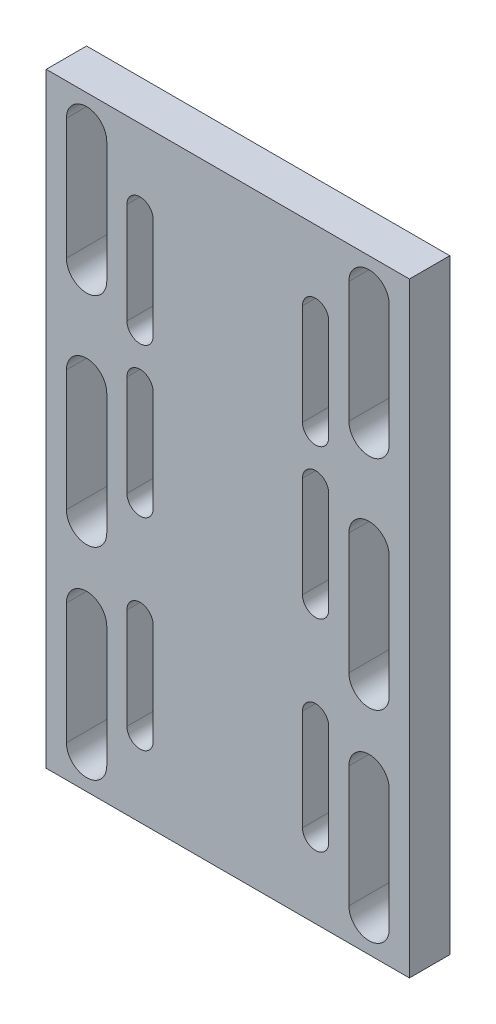
from build123d import *

# Parameters (mm, degrees)
SPLIT_START       = 45
SPLIT_1_OUTLINE_W = 90
SPLIT_1_OUTLINE_H = 100
SPLIT_1_DEPTH     = 10
SKETCH_1_W        = 90
SKETCH_1_H        = 50
EXTRUDE_1_DEPTH   = 10


# Read off the part's stored shape, not the designer's step: 基材零件-專題-1
with BuildPart() as part:
    # Split 1 outline → Split 1 (new body)
    with BuildSketch(Plane.XY.offset(SPLIT_START)):
        with Locations((0, -42)):
            Rectangle(SPLIT_1_OUTLINE_W, SPLIT_1_OUTLINE_H)
        with BuildLine():
            Line((-40, -84), (-40, -54))
            ThreePointArc((-40, -54), (-35, -49), (-30, -54))
            Line((-30, -54), (-30, -84))
            ThreePointArc((-30, -84), (-35, -89), (-40, -84))
        make_face(mode=Mode.SUBTRACT)
        with BuildLine():
            Line((-25, -73), (-25, -48))
            ThreePointArc((-25, -48), (-21.75, -44.75), (-18.5, -48))
            Line((-18.5, -48), (-18.5, -73))
            ThreePointArc((-18.5, -73), (-21.75, -76.25), (-25, -73))
        make_face(mode=Mode.SUBTRACT)
        with BuildLine():
            Line((30, -84), (30, -54))
            ThreePointArc((30, -54), (35, -49), (40, -54))
            Line((40, -54), (40, -84))
            ThreePointArc((40, -84), (35, -89), (30, -84))
        make_face(mode=Mode.SUBTRACT)
        with BuildLine():
            Line((18.5, -73), (18.5, -48))
            ThreePointArc((18.5, -48), (21.75, -44.75), (25, -48))
            Line((25, -48), (25, -73))
            ThreePointArc((25, -73), (21.75, -76.25), (18.5, -73))
        make_face(mode=Mode.SUBTRACT)
        with BuildLine():
            Line((-18.5, -11), (-18.5, -36))
            ThreePointArc((-18.5, -36), (-21.75, -39.25), (-25, -36))
            Line((-25, -36), (-25, -11))
            ThreePointArc((-25, -11), (-21.75, -7.75), (-18.5, -11))
        make_face(mode=Mode.SUBTRACT)
        with BuildLine():
            ThreePointArc((-30, -30), (-35, -35), (-40, -30))
            Line((-40, -30), (-40, 0))
            ThreePointArc((-40, 0), (-35, 5), (-30, 0))
            Line((-30, 0), (-30, -30))
        make_face(mode=Mode.SUBTRACT)
        with BuildLine():
            Line((25, -11), (25, -36))
            ThreePointArc((25, -36), (21.75, -39.25), (18.5, -36))
            Line((18.5, -36), (18.5, -11))
            ThreePointArc((18.5, -11), (21.75, -7.75), (25, -11))
        make_face(mode=Mode.SUBTRACT)
        with BuildLine():
            ThreePointArc((40, -30), (35, -35), (30, -30))
            Line((30, -30), (30, 0))
            ThreePointArc((30, 0), (35, 5), (40, 0))
            Line((40, 0), (40, -30))
        make_face(mode=Mode.SUBTRACT)
    extrude(amount=SPLIT_1_DEPTH)

    # 草圖1 → 填料-伸長1 (add)
    with BuildSketch(Plane.XY.offset(55)):
        with Locations((0, -117)):
            Rectangle(SKETCH_1_W, SKETCH_1_H)
        with BuildLine():
            Line((40, -134), (40, -104))
            ThreePointArc((40, -104), (35, -99), (30, -104))
            Line((30, -104), (30, -134))
            ThreePointArc((30, -134), (35, -139), (40, -134))
        make_face(mode=Mode.SUBTRACT)
        with BuildLine():
            Line((25, -123), (25, -98))
            ThreePointArc((25, -98), (21.75, -94.75), (18.5, -98))
            Line((18.5, -98), (18.5, -123))
            ThreePointArc((18.5, -123), (21.75, -126.25), (25, -123))
        make_face(mode=Mode.SUBTRACT)
        with BuildLine():
            Line((-18.5, -123), (-18.5, -98))
            ThreePointArc((-18.5, -98), (-21.75, -94.75), (-25, -98))
            Line((-25, -98), (-25, -123))
            ThreePointArc((-25, -123), (-21.75, -126.25), (-18.5, -123))
        make_face(mode=Mode.SUBTRACT)
        with BuildLine():
            Line((-40, -134), (-40, -104))
            ThreePointArc((-40, -104), (-35, -99), (-30, -104))
            Line((-30, -104), (-30, -134))
            ThreePointArc((-30, -134), (-35, -139), (-40, -134))
        make_face(mode=Mode.SUBTRACT)
    extrude(amount=-EXTRUDE_1_DEPTH)


solid = part.part
